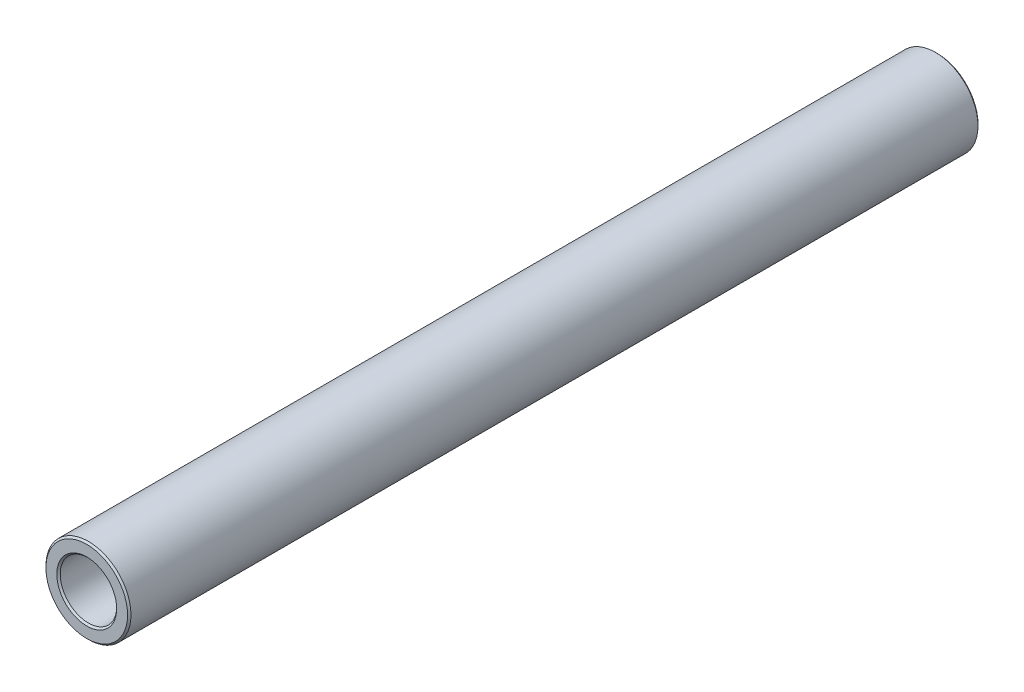
from build123d import *

# Parameters (mm, degrees)
SKETCH1_R           = 3.175
SKETCH1_R_2         = 2.1082
BOSS_EXTRUDE1_DEPTH = 63.5
CHAMFER1_SIZE       = 0.127


with BuildPart() as part:
    # Sketch1 → Boss-Extrude1 (new body)
    with BuildSketch(Plane.XY):
        Circle(SKETCH1_R)
        Circle(SKETCH1_R_2, mode=Mode.SUBTRACT)
    extrude(amount=BOSS_EXTRUDE1_DEPTH)

    # Chamfer1
    chamfer1_edges = [part.edges().sort_by_distance(p)[0] for p in [
        (-2.1082, 0, 0),
        (-3.175, 0, 0),
        (-2.1082, 0, 63.5),
        (-3.175, 0, 63.5),
    ]]
    chamfer(chamfer1_edges, length=CHAMFER1_SIZE)


solid = part.part
